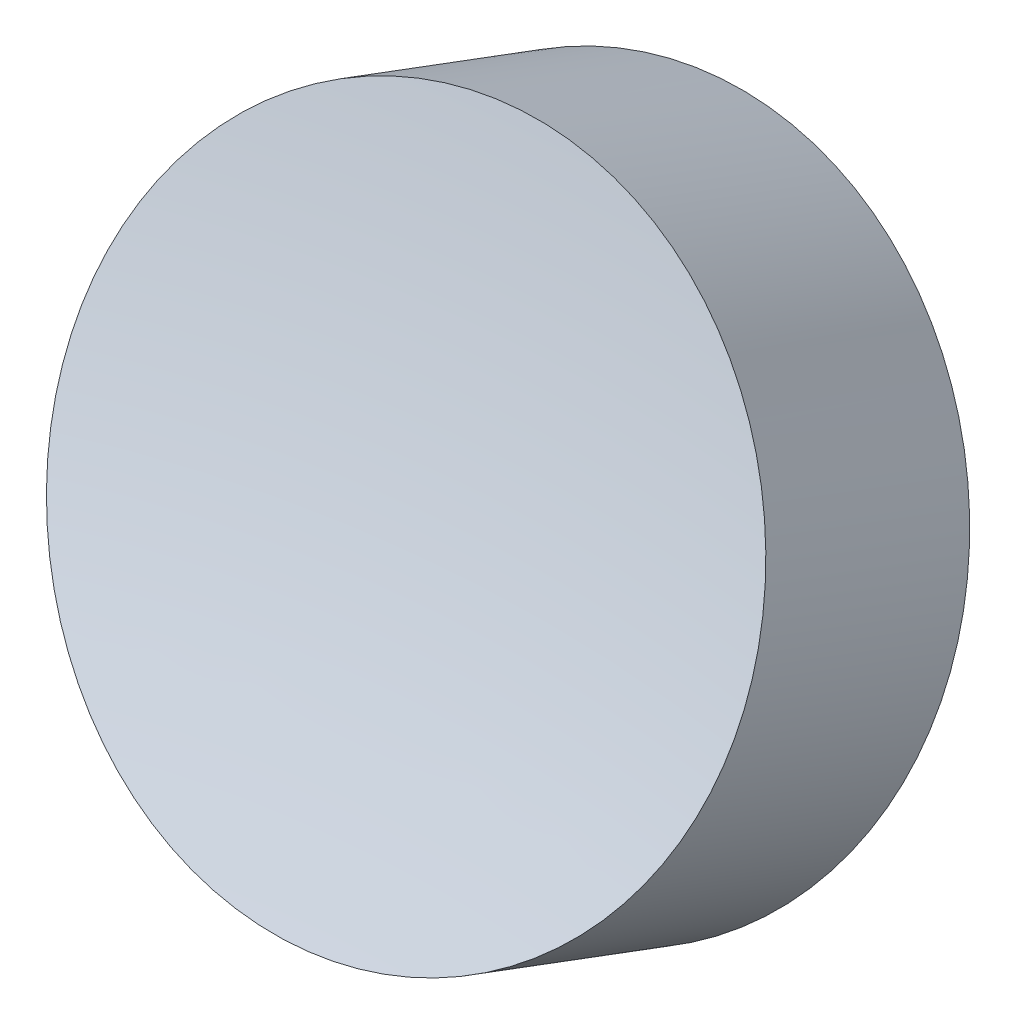
from build123d import *


with BuildPart() as part:
    # Esquisse1 → Révolution1 (revolve)
    with BuildSketch(Plane(origin=(0, -1.422218517, 0.591043356), x_dir=(1, 0, 0), z_dir=(0, -0.9234332960375348, 0.3837589709300026))):
        with BuildLine():
            Line((-2.038710826, 375.00194743), (-2.069846305, 374.50291779))
            ThreePointArc((-2.069846305, 374.50291779), (4.186581866, 374.275515916), (10.446376672, 374.373363052))
            Line((10.446376672, 374.373363052), (9.8617582, 365.003282276))
            Line((9.8617582, 365.003282276), (10.859817481, 364.941011319))
            Line((10.859817481, 364.941011319), (11.482527045, 374.921604127))
            ThreePointArc((11.482527045, 374.921604127), (4.720775585, 374.771179517), (-2.038710826, 375.00194743))
        make_face()
    revolve(axis=Axis((-2.038710826, 142.488142925, 346.880327692), (-0.062270956462349876, -0.38301420252507495, -0.9216411713054843)))


solid = part.part
